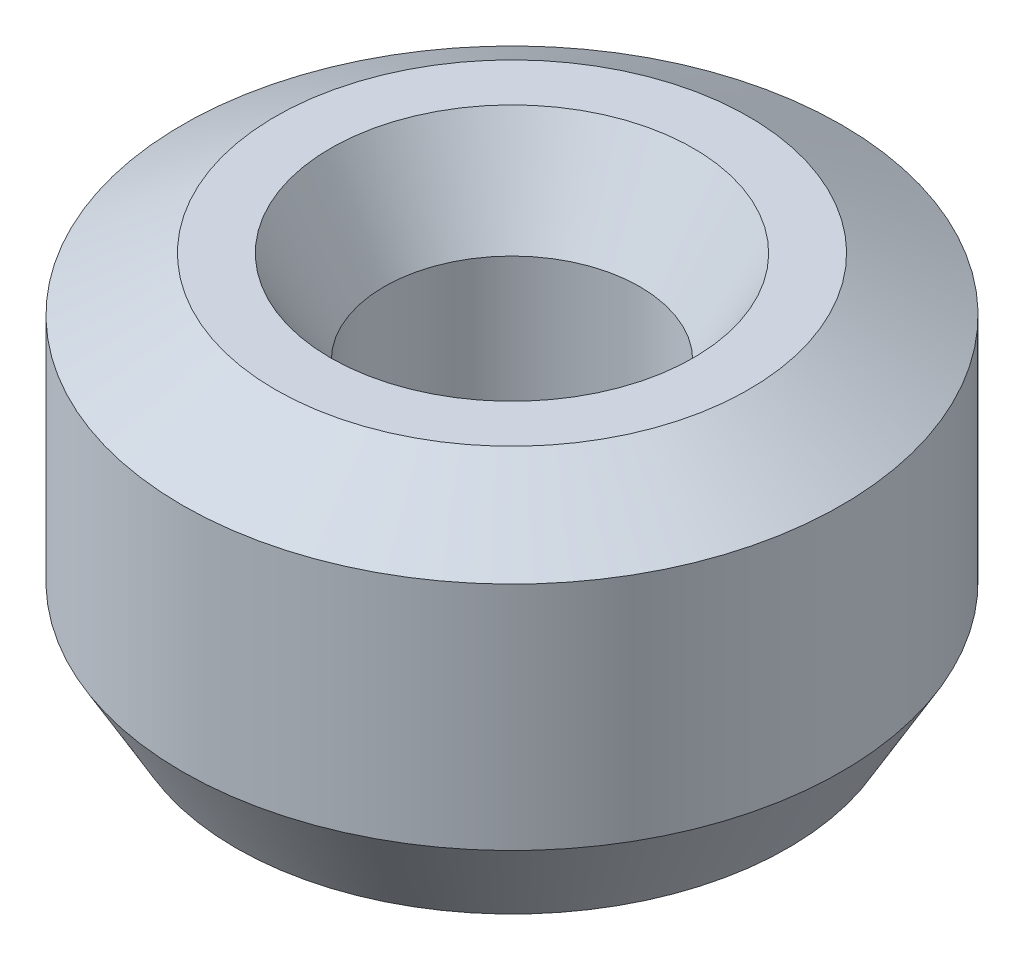
from build123d import *
from OCP.BRepFilletAPI import BRepFilletAPI_MakeChamfer

# Parameters (mm, degrees)
SKETCH1_R           = 22.5
BOSS_EXTRUDE1_DEPTH = 25.76348119
SKETCH2_R           = 8.728241864
CUT_EXTRUDE1_DEPTH  = 41.942117227
CHAMFER1_SIZE       = 3.664049458
CHAMFER1_SIZE2      = 6.346319822


with BuildPart() as part:
    # Sketch1 → Boss-Extrude1 (new body)
    with BuildSketch(Plane(origin=(0, 0, 0), x_dir=(1, 0, 0), z_dir=(0, 1, 0))):
        Circle(SKETCH1_R)
    extrude(amount=BOSS_EXTRUDE1_DEPTH)

    # Sketch2 → Cut-Extrude1 (cut, through all)
    with BuildSketch(Plane(origin=(0, 0, 0), x_dir=(1, 0, 0), z_dir=(0, 1, 0))):
        Circle(SKETCH2_R)
    extrude(amount=CUT_EXTRUDE1_DEPTH, mode=Mode.SUBTRACT)

    # Chamfer1: one chamfer whose edges measure the first distance from different faces: ONE call of the kernel's chamfer builder (chamfer() names one face for all edges)
    chamfer1_edges_1 = [part.edges().sort_by_distance(p)[0] for p in [
        (-8.728241864, 25.76348119, 0),
    ]]
    chamfer1_side_1 = [part.faces().sort_by_distance(p)[0] for p in [
        (-21.863603897, 25.76348119, 0),
    ]]
    chamfer1_edges_2 = [part.edges().sort_by_distance(p)[0] for p in [
        (-8.728241864, 0, 0),
    ]]
    chamfer1_side_2 = [part.faces().sort_by_distance(p)[0] for p in [
        (-8.728241864, 12.881740595, 0),
    ]]
    chamfer1_edges_3 = [part.edges().sort_by_distance(p)[0] for p in [
        (-22.5, 0, 0),
    ]]
    chamfer1_side_3 = [part.faces().sort_by_distance(p)[0] for p in [
        (-21.863603897, 0, 0),
    ]]
    chamfer1_edges_4 = [part.edges().sort_by_distance(p)[0] for p in [
        (-22.5, 25.76348119, 0),
    ]]
    chamfer1_side_4 = [part.faces().sort_by_distance(p)[0] for p in [
        (-22.5, 12.881740595, 0),
    ]]
    chamfer1 = BRepFilletAPI_MakeChamfer(part.part.solid().wrapped)
    for e in chamfer1_edges_1:
        chamfer1.Add(CHAMFER1_SIZE, CHAMFER1_SIZE2, e.wrapped, chamfer1_side_1[0].wrapped)  # the first distance lies on this face
    for e in chamfer1_edges_2:
        chamfer1.Add(CHAMFER1_SIZE, CHAMFER1_SIZE2, e.wrapped, chamfer1_side_2[0].wrapped)  # the first distance lies on this face
    for e in chamfer1_edges_3:
        chamfer1.Add(CHAMFER1_SIZE, CHAMFER1_SIZE2, e.wrapped, chamfer1_side_3[0].wrapped)  # the first distance lies on this face
    for e in chamfer1_edges_4:
        chamfer1.Add(CHAMFER1_SIZE, CHAMFER1_SIZE2, e.wrapped, chamfer1_side_4[0].wrapped)  # the first distance lies on this face
    add(Compound.cast(chamfer1.Shape()), mode=Mode.REPLACE)


solid = part.part
